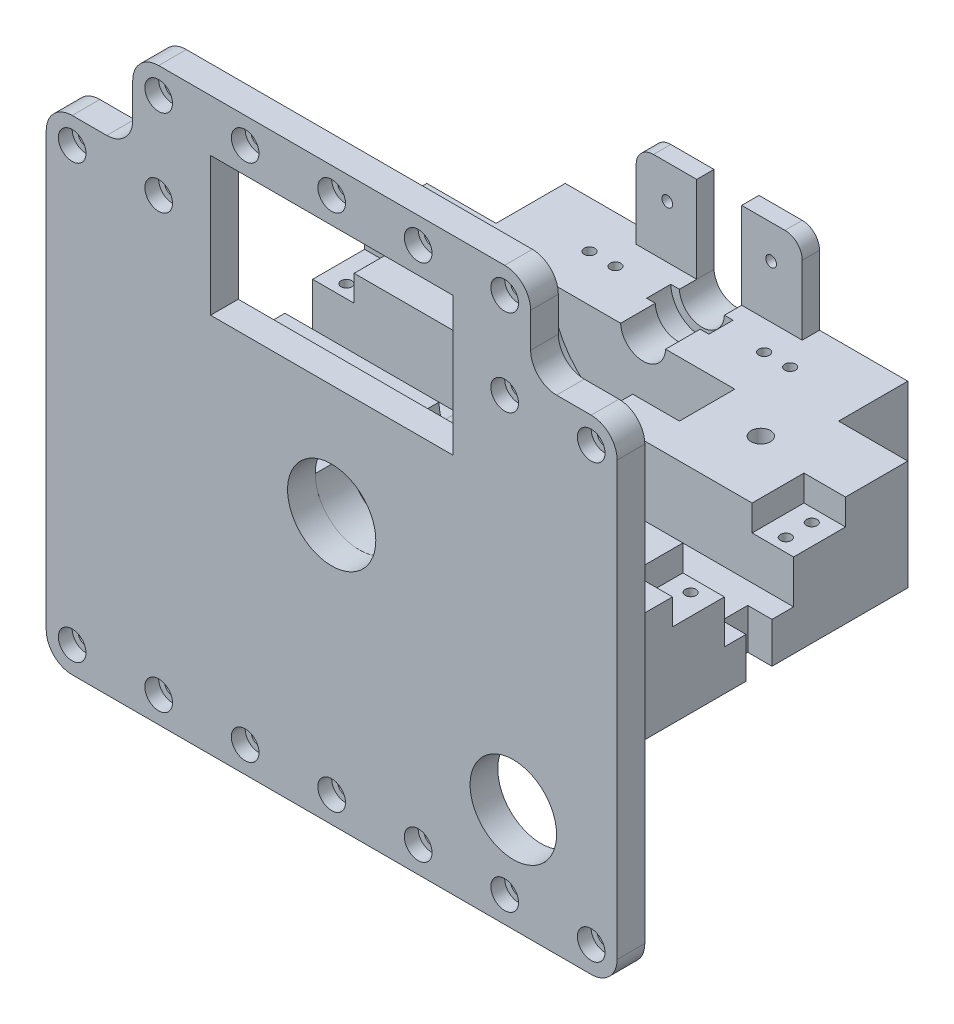
from build123d import *

# Parameters (mm, degrees)
SKETCH2_R                   = 12.5
BOSS_EXTRUDE1_DEPTH         = 8
SKETCH3_R                   = 12.75
CUT_EXTRUDE1_DEPTH          = 8
SKETCH5_W                   = 139
SKETCH5_H                   = 67
BOSS_EXTRUDE2_DEPTH         = 109
CUT_EXTRUDE2_START          = 10
SKETCH6_R                   = 26.5
CUT_EXTRUDE2_DEPTH          = 16
CUT_EXTRUDE3_REACH          = 169.909
SKETCH7_R                   = 6.5
CUT_EXTRUDE4_REACH          = 169.909
SKETCH10_W                  = 139
SKETCH10_H                  = 0.25
CUT_EXTRUDE8_START          = 36
SKETCH15_R                  = 32.5
CUT_EXTRUDE8_DEPTH          = 20
CUT_EXTRUDE9_DEPTH          = 216.172605134
CUT_EXTRUDE9_DEPTH_BACK     = 216.172605134
SKETCH16_W                  = 20
SKETCH16_H                  = 20
CUT_EXTRUDE10_START         = 56
SKETCH17_R                  = 26.5
CUT_EXTRUDE10_DEPTH         = 26
BOSS_EXTRUDE6_START         = 56
SKETCH20_W                  = 139
SKETCH20_H                  = 66.75
BOSS_EXTRUDE6_DEPTH         = 10
CUT_EXTRUDE12_REACH         = 169.909
SKETCH21_R                  = 13
FILLET1_R                   = 5
FILLET2_R                   = 5
CUT_EXTRUDE13_DEPTH         = 168.909201654
CUT_EXTRUDE13_DEPTH_BACK    = 17
CUT_EXTRUDE13_START         = 109
SKETCH22_R                  = 9
BOSS_EXTRUDE7_DEPTH         = 10
SKETCH24_W                  = 30
SKETCH24_H                  = 30
CUT_EXTRUDE14_DEPTH         = 109
CUT_EXTRUDE15_DEPTH         = 196.139052985
CUT_EXTRUDE15_DEPTH_BACK    = 196.139052985
SKETCH25_W                  = 30
SKETCH25_H                  = 30
SKETCH25_W_2                = 43
CUT_EXTRUDE16_DEPTH         = 216.172605134
CUT_EXTRUDE16_DEPTH_BACK    = 12
SKETCH29_W                  = 15
SKETCH29_H                  = 7.5
SKETCH30_W                  = 15
SKETCH30_H                  = 7.5
CUT_EXTRUDE17_DEPTH         = 12
SKETCH31_W                  = 7.5
SKETCH31_H                  = 16.75
CUT_EXTRUDE18_DEPTH         = 7
SKETCH32_W                  = 7.5
SKETCH32_H                  = 16.75
CUT_EXTRUDE19_DEPTH         = 7
CUT_EXTRUDE20_START         = -36.75
CUT_EXTRUDE20_OUTLINE_W     = 20
CUT_EXTRUDE20_OUTLINE_H     = 20
CUT_EXTRUDE20_DEPTH         = 36.75
FILLET3_R                   = 2
FILLET4_R                   = 2
SKETCH39_W                  = 79
SKETCH39_H                  = 5.5
CUT_EXTRUDE21_DEPTH         = 36
CUT_EXTRUDE22_START         = -8
CUT_EXTRUDE22_OUTLINE_R     = 2.25
CUT_EXTRUDE22_OUTLINE_W     = 70
CUT_EXTRUDE22_OUTLINE_H     = 40
CUT_EXTRUDE22_DEPTH         = 8
CUT_EXTRUDE22_START_2       = -4
CUT_EXTRUDE22_2_OUTLINE_R   = 4
CUT_EXTRUDE22_2_OUTLINE_R_2 = 2.25
CUT_EXTRUDE22_2_DEPTH       = 4
CUT_EXTRUDE23_START         = -109
CUT_EXTRUDE23_DEPTH         = 109
SKETCH46_W                  = 17.5
SKETCH46_H                  = 5
BOSS_EXTRUDE8_DEPTH         = 25
FILLET5_R                   = 5
FILLET6_R                   = 5
SKETCH47_R                  = 1.55
CUT_EXTRUDE24_DEPTH         = 10


# Read off the part's stored shape, not the designer's step: Ø1.0mm Dowel Hole2, Cut-Extrude20, Cut-Extrude22
with BuildPart() as part:
    # Sketch2 → Boss-Extrude1 (new body)
    with BuildSketch(Plane.XY):
        with BuildLine():
            Line((-57.5, 60), (-57.5, 50))
            ThreePointArc((-57.5, 50), (-59.696699141, 44.696699141), (-65, 42.5))
            Line((-65, 42.5), (-75, 42.5))
            ThreePointArc((-75, 42.5), (-80.303300859, 40.303300859), (-82.5, 35))
            Line((-82.5, 35), (-82.5, -90))
            ThreePointArc((-82.5, -90), (-80.303300859, -95.303300859), (-75, -97.5))
            Line((-75, -97.5), (75, -97.5))
            ThreePointArc((75, -97.5), (80.303300859, -95.303300859), (82.5, -90))
            Line((82.5, -90), (82.5, 35))
            ThreePointArc((82.5, 35), (80.303300859, 40.303300859), (75, 42.5))
            Line((75, 42.5), (65, 42.5))
            ThreePointArc((65, 42.5), (59.696699141, 44.696699141), (57.5, 50))
            Line((57.5, 50), (57.5, 60))
            ThreePointArc((57.5, 60), (55.303300859, 65.303300859), (50, 67.5))
            Line((50, 67.5), (-50, 67.5))
            ThreePointArc((-50, 67.5), (-55.303300859, 65.303300859), (-57.5, 60))
        make_face()
        with Locations((52.5, -67.5)):
            Circle(SKETCH2_R, mode=Mode.SUBTRACT)
    extrude(amount=-BOSS_EXTRUDE1_DEPTH)

    # Sketch3 → Cut-Extrude1 (cut)
    with BuildSketch(Plane.XY):
        with Locations((0, -20)):
            Circle(SKETCH3_R)
    extrude(amount=-CUT_EXTRUDE1_DEPTH, mode=Mode.SUBTRACT)

    # Sketch5 → Boss-Extrude2 (add)
    with BuildSketch(Plane(origin=(0, 0, -8), x_dir=(-1, 0, 0), z_dir=(0, 0, -1))):
        with Locations((0, -53.5)):
            Rectangle(SKETCH5_W, SKETCH5_H)
    extrude(amount=BOSS_EXTRUDE2_DEPTH)

    # Sketch6 → Cut-Extrude2 (cut)
    with BuildSketch(Plane(origin=(0, 0, -8), x_dir=(-1, 0, 0), z_dir=(0, 0, -1)).offset(CUT_EXTRUDE2_START)):
        with Locations((0, -20)):
            Circle(SKETCH6_R)
    extrude(amount=CUT_EXTRUDE2_DEPTH, mode=Mode.SUBTRACT)

    # Cut-Extrude3: up to this face of the body (flat: up to its plane)
    cut_extrude3_end = Plane(part.part.faces().sort_by_distance((0, -53.5, -117))[0])
    # Sketch7 → Cut-Extrude3 (cut, up to the picked face)
    with BuildSketch(Plane(origin=(0, 0, -8), x_dir=(-1, 0, 0), z_dir=(0, 0, -1)), mode=Mode.PRIVATE) as cut_extrude3_sk1:
        with Locations((0, -20)):
            Circle(SKETCH7_R)
    cut_extrude3_tool1 = split(extrude(cut_extrude3_sk1.sketch, amount=CUT_EXTRUDE3_REACH, mode=Mode.PRIVATE), bisect_by=cut_extrude3_end, keep=Keep.BOTH, mode=Mode.PRIVATE)
    add(cut_extrude3_tool1.solids().sort_by(Axis((0, -20, -8), (0, 0, -1)))[0], mode=Mode.SUBTRACT)

    # Cut-Extrude4: up to this face of the body (flat: up to its plane)
    cut_extrude4_end = Plane(part.part.faces().sort_by_distance((0, -53.720640565, -117))[0])
    # Sketch10 → Cut-Extrude4 (cut, up to the picked face)
    with BuildSketch(Plane(origin=(0, 0, -8), x_dir=(-1, 0, 0), z_dir=(0, 0, -1)), mode=Mode.PRIVATE) as cut_extrude4_sk1:
        with Locations((0, -20.125)):
            Rectangle(SKETCH10_W, SKETCH10_H)
    cut_extrude4_tool1 = split(extrude(cut_extrude4_sk1.sketch, amount=CUT_EXTRUDE4_REACH, mode=Mode.PRIVATE), bisect_by=cut_extrude4_end, keep=Keep.BOTH, mode=Mode.PRIVATE)
    add(cut_extrude4_tool1.solids().sort_by(Axis((0, -20.125, -8), (0, 0, -1)))[0], mode=Mode.SUBTRACT)

    # Sketch15 → Cut-Extrude8 (cut)
    with BuildSketch(Plane(origin=(0, 0, -8), x_dir=(-1, 0, 0), z_dir=(0, 0, -1)).offset(CUT_EXTRUDE8_START)):
        with Locations((0, -20)):
            Circle(SKETCH15_R)
    extrude(amount=CUT_EXTRUDE8_DEPTH, mode=Mode.SUBTRACT)

    # Sketch16 → Cut-Extrude9 (cut, two sides: drawn at the far end of the back side and taken through both)
    with BuildSketch(Plane(origin=(69.5, 0, 0), x_dir=(0, 0, -1), z_dir=(1, 0, 0)).offset(-CUT_EXTRUDE9_DEPTH_BACK)):
        with Locations((54, -30.25)):
            Rectangle(SKETCH16_W, SKETCH16_H)
    extrude(amount=CUT_EXTRUDE9_DEPTH + CUT_EXTRUDE9_DEPTH_BACK, mode=Mode.SUBTRACT)

    # Sketch17 → Cut-Extrude10 (cut)
    with BuildSketch(Plane(origin=(0, 0, -8), x_dir=(-1, 0, 0), z_dir=(0, 0, -1)).offset(CUT_EXTRUDE10_START)):
        with Locations((0, -20)):
            Circle(SKETCH17_R)
    extrude(amount=CUT_EXTRUDE10_DEPTH, mode=Mode.SUBTRACT)

    # Sketch20 → Boss-Extrude6 (add)
    with BuildSketch(Plane(origin=(0, 0, -8), x_dir=(-1, 0, 0), z_dir=(0, 0, -1)).offset(BOSS_EXTRUDE6_START)):
        with Locations((0, -53.625)):
            Rectangle(SKETCH20_W, SKETCH20_H)
    extrude(amount=BOSS_EXTRUDE6_DEPTH)

    # Cut-Extrude12: up to this face of the body (flat: up to its plane)
    cut_extrude12_end = Plane(part.part.faces().sort_by_distance((0, -31.382164936, -74))[0])
    # Sketch21 → Cut-Extrude12 (cut, up to the picked face)
    with BuildSketch(Plane(origin=(0, 0, -8), x_dir=(-1, 0, 0), z_dir=(0, 0, -1)), mode=Mode.PRIVATE) as cut_extrude12_sk1:
        with Locations((0, -20)):
            Circle(SKETCH21_R)
    cut_extrude12_tool1 = split(extrude(cut_extrude12_sk1.sketch, amount=CUT_EXTRUDE12_REACH, mode=Mode.PRIVATE), bisect_by=cut_extrude12_end, keep=Keep.BOTH, mode=Mode.PRIVATE)
    add(cut_extrude12_tool1.solids().sort_by(Axis((0, -20, -8), (0, 0, -1)))[0], mode=Mode.SUBTRACT)

    # Fillet1
    fillet1_edges = [part.edges().sort_by_distance(p)[0] for p in [
        (25.420218331, -40.25, -54),
    ]]
    fillet(fillet1_edges, radius=FILLET1_R)

    # Fillet2
    fillet2_edges = [part.edges().sort_by_distance(p)[0] for p in [
        (-25.420218331, -40.25, -54),
    ]]
    fillet(fillet2_edges, radius=FILLET2_R)

    # Sketch22 → Cut-Extrude13 (cut, two sides: drawn at the far end of the back side and taken through both)
    with BuildSketch(Plane(origin=(0, 0, -8), x_dir=(-1, 0, 0), z_dir=(0, 0, -1)).offset(CUT_EXTRUDE13_START - CUT_EXTRUDE13_DEPTH_BACK)):
        with Locations((0, -20)):
            Circle(SKETCH22_R)
    extrude(amount=CUT_EXTRUDE13_DEPTH + CUT_EXTRUDE13_DEPTH_BACK, mode=Mode.SUBTRACT)

    # Sketch23 → Boss-Extrude7 (add)
    with BuildSketch(Plane(origin=(0, 0, -117), x_dir=(-1, 0, 0), z_dir=(0, 0, -1))):
        with BuildLine():
            Line((-8.996527108, -20.25), (-6.495190528, -20.25))
            ThreePointArc((-6.495190528, -20.25), (0, -26.5), (6.495190528, -20.25))
            Line((6.495190528, -20.25), (8.996527108, -20.25))
            ThreePointArc((8.996527108, -20.25), (0, -29), (-8.996527108, -20.25))
        make_face()
    extrude(amount=-BOSS_EXTRUDE7_DEPTH)

    # Sketch24 → Cut-Extrude14 (cut)
    with BuildSketch(Plane(origin=(0, 0, -117), x_dir=(-1, 0, 0), z_dir=(0, 0, -1))):
        with Locations((-54.5, -72)):
            Rectangle(SKETCH24_W, SKETCH24_H)
        with Locations((54.5, -72)):
            Rectangle(SKETCH24_W, SKETCH24_H)
    extrude(amount=-CUT_EXTRUDE14_DEPTH, mode=Mode.SUBTRACT)

    # Sketch25 → Cut-Extrude15 (cut, two sides: drawn at the far end of the back side and taken through both)
    with BuildSketch(Plane(origin=(39.5, 0, 0), x_dir=(0, 0, -1), z_dir=(1, 0, 0)).offset(-CUT_EXTRUDE15_DEPTH_BACK)):
        with Locations((23, -72)):
            Rectangle(SKETCH25_W, SKETCH25_H)
        with Locations((95.5, -72)):
            Rectangle(SKETCH25_W_2, SKETCH25_H)
    extrude(amount=CUT_EXTRUDE15_DEPTH + CUT_EXTRUDE15_DEPTH_BACK, mode=Mode.SUBTRACT)

    # Sketch29 → Cut-Extrude16 (cut, two sides: drawn at the far end of the back side and taken through both)
    with BuildSketch(Plane(origin=(69.5, 0, 0), x_dir=(0, 0, -1), z_dir=(1, 0, 0)).offset(-CUT_EXTRUDE16_DEPTH_BACK)):
        with Locations((36.5, -24)):
            Rectangle(SKETCH29_W, SKETCH29_H)
        with Locations((71.5, -24)):
            Rectangle(SKETCH29_W, SKETCH29_H)
    extrude(amount=CUT_EXTRUDE16_DEPTH + CUT_EXTRUDE16_DEPTH_BACK, mode=Mode.SUBTRACT)

    # Sketch30 → Cut-Extrude17 (cut)
    with BuildSketch(Plane.ZY.offset(69.5)):
        with Locations((-36.5, -24)):
            Rectangle(SKETCH30_W, SKETCH30_H)
        with Locations((-71.5, -24)):
            Rectangle(SKETCH30_W, SKETCH30_H)
    extrude(amount=-CUT_EXTRUDE17_DEPTH, mode=Mode.SUBTRACT)

    # Sketch31 → Cut-Extrude18 (cut)
    with BuildSketch(Plane.ZY.offset(69.5)):
        with Locations((-54, -48.625)):
            Rectangle(SKETCH31_W, SKETCH31_H)
    extrude(amount=-CUT_EXTRUDE18_DEPTH, mode=Mode.SUBTRACT)

    # Sketch32 → Cut-Extrude19 (cut)
    with BuildSketch(Plane(origin=(69.5, 0, 0), x_dir=(0, 0, -1), z_dir=(1, 0, 0))):
        with Locations((54, -48.625)):
            Rectangle(SKETCH32_W, SKETCH32_H)
    extrude(amount=-CUT_EXTRUDE19_DEPTH, mode=Mode.SUBTRACT)

    # Ø1.0mm Dowel Hole2 outline → Ø1.0mm Dowel Hole2 (revolve, cut)
    with BuildSketch(Plane(origin=(-21.489433475, 0, -103.5), x_dir=(1, 0, 0), z_dir=(0, 0, 1))):
        Polygon((0, -20.25), (0, -46.181333959), (1.55, -45.25), (1.55, -20.25), align=None)
    revolve(axis=Axis((-21.489433475, 0, -103.5), (0, 1, 0)), mode=Mode.SUBTRACT)

    # 1.0mm Dowel Hole2 2 outline → 1.0mm Dowel Hole2 2 (revolve, cut)
    with BuildSketch(Plane(origin=(-28.989433475, 0, -103.5), x_dir=(1, 0, 0), z_dir=(0, 0, 1))):
        Polygon((0, -20.25), (0, -46.181333959), (1.55, -45.25), (1.55, -20.25), align=None)
    revolve(axis=Axis((-28.989433475, 0, -103.5), (0, 1, 0)), mode=Mode.SUBTRACT)

    # 1.0mm Dowel Hole2 3 outline → 1.0mm Dowel Hole2 3 (revolve, cut)
    with BuildSketch(Plane(origin=(21.489433475, 0, -103.5), x_dir=(1, 0, 0), z_dir=(0, 0, 1))):
        Polygon((0, -20.25), (0, -46.181333959), (1.55, -45.25), (1.55, -20.25), align=None)
    revolve(axis=Axis((21.489433475, 0, -103.5), (0, 1, 0)), mode=Mode.SUBTRACT)

    # 1.0mm Dowel Hole2 4 outline → 1.0mm Dowel Hole2 4 (revolve, cut)
    with BuildSketch(Plane(origin=(28.989433475, 0, -103.5), x_dir=(1, 0, 0), z_dir=(0, 0, 1))):
        Polygon((0, -20.25), (0, -46.181333959), (1.55, -45.25), (1.55, -20.25), align=None)
    revolve(axis=Axis((28.989433475, 0, -103.5), (0, 1, 0)), mode=Mode.SUBTRACT)

    # 1.0mm Dowel Hole2 5 outline → 1.0mm Dowel Hole2 5 (revolve, cut)
    with BuildSketch(Plane(origin=(63.5, 0, -32.75), x_dir=(1, 0, 0), z_dir=(0, 0, 1))):
        Polygon((0, -27.75), (0, -46.181333959), (1.55, -45.25), (1.55, -27.75), align=None)
    revolve(axis=Axis((63.5, 0, -32.75), (0, 1, 0)), mode=Mode.SUBTRACT)

    # 1.0mm Dowel Hole2 6 outline → 1.0mm Dowel Hole2 6 (revolve, cut)
    with BuildSketch(Plane(origin=(63.5, 0, -40.25), x_dir=(1, 0, 0), z_dir=(0, 0, 1))):
        Polygon((0, -27.75), (0, -46.181333959), (1.55, -45.25), (1.55, -27.75), align=None)
    revolve(axis=Axis((63.5, 0, -40.25), (0, 1, 0)), mode=Mode.SUBTRACT)

    # 1.0mm Dowel Hole2 7 outline → 1.0mm Dowel Hole2 7 (revolve, cut)
    with BuildSketch(Plane(origin=(63.5, 0, -67.75), x_dir=(1, 0, 0), z_dir=(0, 0, 1))):
        Polygon((0, -27.75), (0, -46.181333959), (1.55, -45.25), (1.55, -27.75), align=None)
    revolve(axis=Axis((63.5, 0, -67.75), (0, 1, 0)), mode=Mode.SUBTRACT)

    # 1.0mm Dowel Hole2 8 outline → 1.0mm Dowel Hole2 8 (revolve, cut)
    with BuildSketch(Plane(origin=(63.5, 0, -75.25), x_dir=(1, 0, 0), z_dir=(0, 0, 1))):
        Polygon((0, -27.75), (0, -46.181333959), (1.55, -45.25), (1.55, -27.75), align=None)
    revolve(axis=Axis((63.5, 0, -75.25), (0, 1, 0)), mode=Mode.SUBTRACT)

    # 1.0mm Dowel Hole2 9 outline → 1.0mm Dowel Hole2 9 (revolve, cut)
    with BuildSketch(Plane(origin=(-63.5, 0, -32.75), x_dir=(1, 0, 0), z_dir=(0, 0, 1))):
        Polygon((0, -46.181333959), (1.55, -45.25), (1.55, -27.75), (0, -27.75), align=None)
    revolve(axis=Axis((-63.5, 0, -32.75), (0, 1, 0)), mode=Mode.SUBTRACT)

    # 1.0mm Dowel Hole2 10 outline → 1.0mm Dowel Hole2 10 (revolve, cut)
    with BuildSketch(Plane(origin=(-63.5, 0, -40.25), x_dir=(1, 0, 0), z_dir=(0, 0, 1))):
        Polygon((0, -46.181333959), (1.55, -45.25), (1.55, -27.75), (0, -27.75), align=None)
    revolve(axis=Axis((-63.5, 0, -40.25), (0, 1, 0)), mode=Mode.SUBTRACT)

    # 1.0mm Dowel Hole2 11 outline → 1.0mm Dowel Hole2 11 (revolve, cut)
    with BuildSketch(Plane(origin=(-63.5, 0, -67.75), x_dir=(1, 0, 0), z_dir=(0, 0, 1))):
        Polygon((0, -46.181333959), (1.55, -45.25), (1.55, -27.75), (0, -27.75), align=None)
    revolve(axis=Axis((-63.5, 0, -67.75), (0, 1, 0)), mode=Mode.SUBTRACT)

    # 1.0mm Dowel Hole2 12 outline → 1.0mm Dowel Hole2 12 (revolve, cut)
    with BuildSketch(Plane(origin=(-63.5, 0, -75.25), x_dir=(1, 0, 0), z_dir=(0, 0, 1))):
        Polygon((0, -46.181333959), (1.55, -45.25), (1.55, -27.75), (0, -27.75), align=None)
    revolve(axis=Axis((-63.5, 0, -75.25), (0, 1, 0)), mode=Mode.SUBTRACT)

    # Cut-Extrude20 outline → Cut-Extrude20 (cut)
    with BuildSketch(Plane(origin=(0, -20.25, 0), x_dir=(1, 0, 0), z_dir=(0, 1, 0)).offset(CUT_EXTRUDE20_START)):
        with Locations((-59.5, 107)):
            Rectangle(CUT_EXTRUDE20_OUTLINE_W, CUT_EXTRUDE20_OUTLINE_H)
        with Locations((59.5, 107)):
            Rectangle(CUT_EXTRUDE20_OUTLINE_W, CUT_EXTRUDE20_OUTLINE_H)
    extrude(amount=CUT_EXTRUDE20_DEPTH, mode=Mode.SUBTRACT)

    # Cut-Extrude20 2 outline → Cut-Extrude20 2 (revolve, cut)
    with BuildSketch(Plane(origin=(42.023421599, 0, -82), x_dir=(1, 0, 0), z_dir=(0, 0, 1))):
        Polygon((0, -20.25), (0, -46.932409733), (2.8, -45.25), (2.8, -20.25), align=None)
    revolve(axis=Axis((42.023421599, 0, -82), (0, 1, 0)), mode=Mode.SUBTRACT)

    # Cut-Extrude20 3 outline → Cut-Extrude20 3 (revolve, cut)
    with BuildSketch(Plane(origin=(42.023421599, 0, -26), x_dir=(1, 0, 0), z_dir=(0, 0, 1))):
        Polygon((0, -20.25), (0, -46.932409733), (2.8, -45.25), (2.8, -20.25), align=None)
    revolve(axis=Axis((42.023421599, 0, -26), (0, 1, 0)), mode=Mode.SUBTRACT)

    # Cut-Extrude20 4 outline → Cut-Extrude20 4 (revolve, cut)
    with BuildSketch(Plane(origin=(-42.023421599, 0, -26), x_dir=(1, 0, 0), z_dir=(0, 0, 1))):
        Polygon((0, -20.25), (0, -46.932409733), (2.8, -45.25), (2.8, -20.25), align=None)
    revolve(axis=Axis((-42.023421599, 0, -26), (0, 1, 0)), mode=Mode.SUBTRACT)

    # Cut-Extrude20 5 outline → Cut-Extrude20 5 (revolve, cut)
    with BuildSketch(Plane(origin=(-42.023421599, 0, -82), x_dir=(1, 0, 0), z_dir=(0, 0, 1))):
        Polygon((0, -20.25), (0, -46.932409733), (2.8, -45.25), (2.8, -20.25), align=None)
    revolve(axis=Axis((-42.023421599, 0, -82), (0, 1, 0)), mode=Mode.SUBTRACT)

    # Fillet3
    fillet3_edges = [part.edges().sort_by_distance(p)[0] for p in [
        (62.5, -57, -54),
    ]]
    fillet(fillet3_edges, radius=FILLET3_R)

    # Fillet4
    fillet4_edges = [part.edges().sort_by_distance(p)[0] for p in [
        (-62.5, -57, -54),
    ]]
    fillet(fillet4_edges, radius=FILLET4_R)

    # Sketch39 → Cut-Extrude21 (cut)
    with BuildSketch(Plane(origin=(0, 0, -74), x_dir=(-1, 0, 0), z_dir=(0, 0, -1))):
        with Locations((0, -84.25)):
            Rectangle(SKETCH39_W, SKETCH39_H)
    extrude(amount=-CUT_EXTRUDE21_DEPTH, mode=Mode.SUBTRACT)

    # Cut-Extrude22 outline → Cut-Extrude22 (cut)
    with BuildSketch(Plane.XY.offset(CUT_EXTRUDE22_START)):
        with Locations((75, -90)):
            Circle(CUT_EXTRUDE22_OUTLINE_R)
        with Locations((50, -90)):
            Circle(CUT_EXTRUDE22_OUTLINE_R)
        with Locations((25, -90)):
            Circle(CUT_EXTRUDE22_OUTLINE_R)
        with Locations((0, -90)):
            Circle(CUT_EXTRUDE22_OUTLINE_R)
        with Locations((-25, -90)):
            Circle(CUT_EXTRUDE22_OUTLINE_R)
        with Locations((-50, -90)):
            Circle(CUT_EXTRUDE22_OUTLINE_R)
        with Locations((-75, -90)):
            Circle(CUT_EXTRUDE22_OUTLINE_R)
        with Locations((75, 35)):
            Circle(CUT_EXTRUDE22_OUTLINE_R)
        with Locations((50, 35)):
            Circle(CUT_EXTRUDE22_OUTLINE_R)
        with Locations((50, 60)):
            Circle(CUT_EXTRUDE22_OUTLINE_R)
        with Locations((25, 60)):
            Circle(CUT_EXTRUDE22_OUTLINE_R)
        with Locations((0, 60)):
            Circle(CUT_EXTRUDE22_OUTLINE_R)
        with Locations((-25, 60)):
            Circle(CUT_EXTRUDE22_OUTLINE_R)
        with Locations((-50, 60)):
            Circle(CUT_EXTRUDE22_OUTLINE_R)
        with Locations((-50, 35)):
            Circle(CUT_EXTRUDE22_OUTLINE_R)
        with Locations((-75, 35)):
            Circle(CUT_EXTRUDE22_OUTLINE_R)
        with Locations((0, 32.5)):
            Rectangle(CUT_EXTRUDE22_OUTLINE_W, CUT_EXTRUDE22_OUTLINE_H)
    extrude(amount=CUT_EXTRUDE22_DEPTH, mode=Mode.SUBTRACT)

    # Cut-Extrude22 2 outline → Cut-Extrude22 2 (cut)
    # profile 1 of 16: a face of its own
    with BuildSketch(Plane.XY.offset(CUT_EXTRUDE22_START_2)):
        with Locations((75, -90)):
            Circle(CUT_EXTRUDE22_2_OUTLINE_R)
        with Locations((75, -90)):
            Circle(CUT_EXTRUDE22_2_OUTLINE_R_2, mode=Mode.SUBTRACT)
    # profile 2 of 16: a face of its own
    with BuildSketch(Plane.XY.offset(CUT_EXTRUDE22_START_2)):
        with Locations((50, -90)):
            Circle(CUT_EXTRUDE22_2_OUTLINE_R)
        with Locations((50, -90)):
            Circle(CUT_EXTRUDE22_2_OUTLINE_R_2, mode=Mode.SUBTRACT)
    # profile 3 of 16: a face of its own
    with BuildSketch(Plane.XY.offset(CUT_EXTRUDE22_START_2)):
        with Locations((25, -90)):
            Circle(CUT_EXTRUDE22_2_OUTLINE_R)
        with Locations((25, -90)):
            Circle(CUT_EXTRUDE22_2_OUTLINE_R_2, mode=Mode.SUBTRACT)
    # profile 4 of 16: a face of its own
    with BuildSketch(Plane.XY.offset(CUT_EXTRUDE22_START_2)):
        with Locations((0, -90)):
            Circle(CUT_EXTRUDE22_2_OUTLINE_R)
        with Locations((0, -90)):
            Circle(CUT_EXTRUDE22_2_OUTLINE_R_2, mode=Mode.SUBTRACT)
    # profile 5 of 16: a face of its own
    with BuildSketch(Plane.XY.offset(CUT_EXTRUDE22_START_2)):
        with Locations((-25, -90)):
            Circle(CUT_EXTRUDE22_2_OUTLINE_R)
        with Locations((-25, -90)):
            Circle(CUT_EXTRUDE22_2_OUTLINE_R_2, mode=Mode.SUBTRACT)
    # profile 6 of 16: a face of its own
    with BuildSketch(Plane.XY.offset(CUT_EXTRUDE22_START_2)):
        with Locations((-50, -90)):
            Circle(CUT_EXTRUDE22_2_OUTLINE_R)
        with Locations((-50, -90)):
            Circle(CUT_EXTRUDE22_2_OUTLINE_R_2, mode=Mode.SUBTRACT)
    # profile 7 of 16: a face of its own
    with BuildSketch(Plane.XY.offset(CUT_EXTRUDE22_START_2)):
        with Locations((-75, -90)):
            Circle(CUT_EXTRUDE22_2_OUTLINE_R)
        with Locations((-75, -90)):
            Circle(CUT_EXTRUDE22_2_OUTLINE_R_2, mode=Mode.SUBTRACT)
    # profile 8 of 16: a face of its own
    with BuildSketch(Plane.XY.offset(CUT_EXTRUDE22_START_2)):
        with Locations((75, 35)):
            Circle(CUT_EXTRUDE22_2_OUTLINE_R)
        with Locations((75, 35)):
            Circle(CUT_EXTRUDE22_2_OUTLINE_R_2, mode=Mode.SUBTRACT)
    # profile 9 of 16: a face of its own
    with BuildSketch(Plane.XY.offset(CUT_EXTRUDE22_START_2)):
        with Locations((50, 35)):
            Circle(CUT_EXTRUDE22_2_OUTLINE_R)
        with Locations((50, 35)):
            Circle(CUT_EXTRUDE22_2_OUTLINE_R_2, mode=Mode.SUBTRACT)
    # profile 10 of 16: a face of its own
    with BuildSketch(Plane.XY.offset(CUT_EXTRUDE22_START_2)):
        with Locations((50, 60)):
            Circle(CUT_EXTRUDE22_2_OUTLINE_R)
        with Locations((50, 60)):
            Circle(CUT_EXTRUDE22_2_OUTLINE_R_2, mode=Mode.SUBTRACT)
    # profile 11 of 16: a face of its own
    with BuildSketch(Plane.XY.offset(CUT_EXTRUDE22_START_2)):
        with Locations((25, 60)):
            Circle(CUT_EXTRUDE22_2_OUTLINE_R)
        with Locations((25, 60)):
            Circle(CUT_EXTRUDE22_2_OUTLINE_R_2, mode=Mode.SUBTRACT)
    # profile 12 of 16: a face of its own
    with BuildSketch(Plane.XY.offset(CUT_EXTRUDE22_START_2)):
        with Locations((0, 60)):
            Circle(CUT_EXTRUDE22_2_OUTLINE_R)
        with Locations((0, 60)):
            Circle(CUT_EXTRUDE22_2_OUTLINE_R_2, mode=Mode.SUBTRACT)
    # profile 13 of 16: a face of its own
    with BuildSketch(Plane.XY.offset(CUT_EXTRUDE22_START_2)):
        with Locations((-25, 60)):
            Circle(CUT_EXTRUDE22_2_OUTLINE_R)
        with Locations((-25, 60)):
            Circle(CUT_EXTRUDE22_2_OUTLINE_R_2, mode=Mode.SUBTRACT)
    # profile 14 of 16: a face of its own
    with BuildSketch(Plane.XY.offset(CUT_EXTRUDE22_START_2)):
        with Locations((-50, 60)):
            Circle(CUT_EXTRUDE22_2_OUTLINE_R)
        with Locations((-50, 60)):
            Circle(CUT_EXTRUDE22_2_OUTLINE_R_2, mode=Mode.SUBTRACT)
    # profile 15 of 16: a face of its own
    with BuildSketch(Plane.XY.offset(CUT_EXTRUDE22_START_2)):
        with Locations((-50, 35)):
            Circle(CUT_EXTRUDE22_2_OUTLINE_R)
        with Locations((-50, 35)):
            Circle(CUT_EXTRUDE22_2_OUTLINE_R_2, mode=Mode.SUBTRACT)
    # profile 16 of 16: a face of its own
    with BuildSketch(Plane.XY.offset(CUT_EXTRUDE22_START_2)):
        with Locations((-75, 35)):
            Circle(CUT_EXTRUDE22_2_OUTLINE_R)
        with Locations((-75, 35)):
            Circle(CUT_EXTRUDE22_2_OUTLINE_R_2, mode=Mode.SUBTRACT)
    extrude(amount=CUT_EXTRUDE22_2_DEPTH, mode=Mode.SUBTRACT)

    # Sketch44 → Cut-Extrude23 (cut)
    with BuildSketch(Plane(origin=(0, 0, -117), x_dir=(-1, 0, 0), z_dir=(0, 0, -1)).offset(CUT_EXTRUDE23_START)):
        Polygon((-69.5, -57), (-39.5, -57), (-39.5, -81.5), (-37, -81.5), (-37, -52), (-69.5, -52), align=None)
        Polygon((39.5, -57), (69.5, -57), (69.5, -52), (37, -52), (37, -81.5), (39.5, -81.5), align=None)
    extrude(amount=CUT_EXTRUDE23_DEPTH, mode=Mode.SUBTRACT)

    # Sketch46 → Boss-Extrude8 (add)
    with BuildSketch(Plane(origin=(0, -20.25, 0), x_dir=(1, 0, 0), z_dir=(0, 1, 0))):
        with Locations((-15.245190528, 114.5)):
            Rectangle(SKETCH46_W, SKETCH46_H)
        with Locations((15.245190528, 114.5)):
            Rectangle(SKETCH46_W, SKETCH46_H)
    extrude(amount=BOSS_EXTRUDE8_DEPTH)

    # Fillet5
    fillet5_edges = [part.edges().sort_by_distance(p)[0] for p in [
        (23.995190528, 4.75, -114.5),
    ]]
    fillet(fillet5_edges, radius=FILLET5_R)

    # Fillet6
    fillet6_edges = [part.edges().sort_by_distance(p)[0] for p in [
        (-23.995190528, 4.75, -114.5),
    ]]
    fillet(fillet6_edges, radius=FILLET6_R)

    # Sketch47 → Cut-Extrude24 (cut)
    with BuildSketch(Plane(origin=(0, 0, -117), x_dir=(-1, 0, 0), z_dir=(0, 0, -1))):
        with Locations((-15, -5)):
            Circle(SKETCH47_R)
        with Locations((15, -5)):
            Circle(SKETCH47_R)
        with Locations((15, -35)):
            Circle(SKETCH47_R)
        with Locations((-15, -35)):
            Circle(SKETCH47_R)
    extrude(amount=-CUT_EXTRUDE24_DEPTH, mode=Mode.SUBTRACT)


solid = part.part
